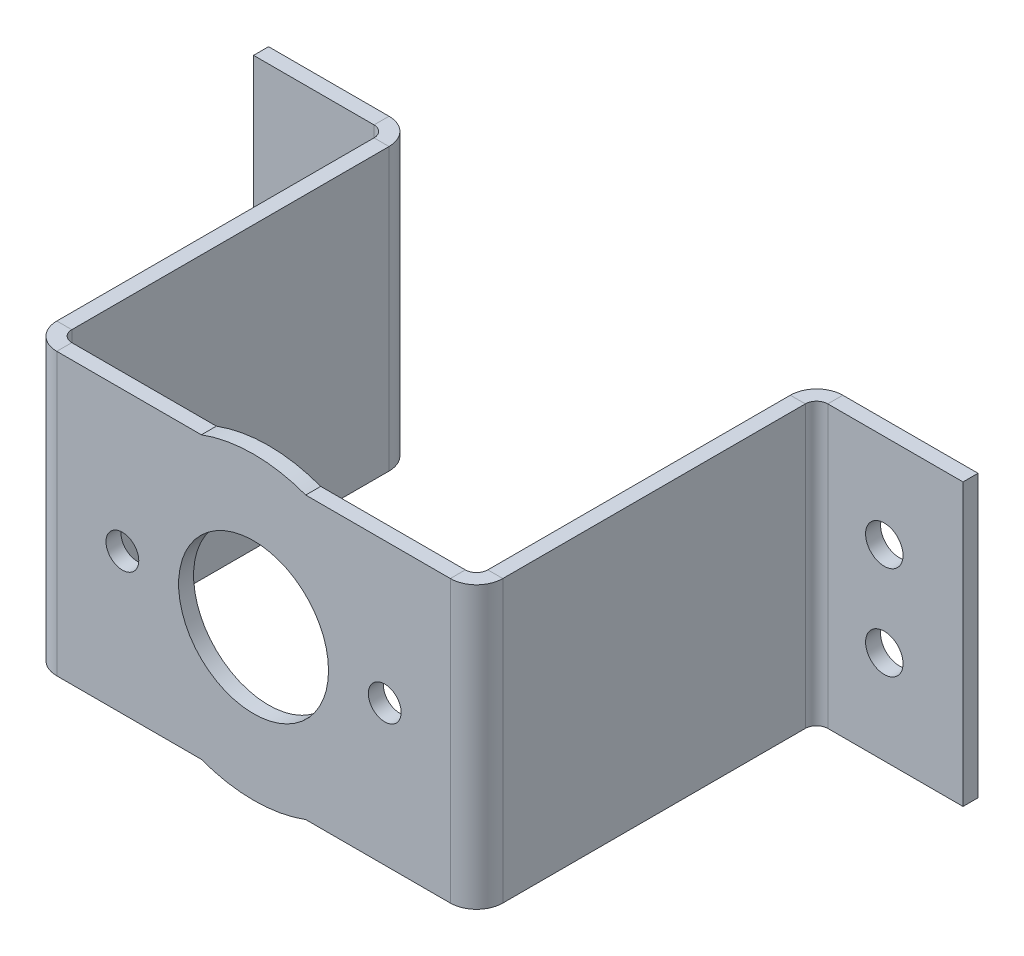
from build123d import *

# Parameters (mm, degrees)
SKETCH1_W                  = 149
SKETCH1_H                  = 30
BOSS_EXTRUDE1_DEPTH        = 1.6
SKETCH4_R                  = 16
BOSS_EXTRUDE2_DEPTH        = 1.6
SKETCH5_R                  = 8
CUT_EXTRUDE1_DEPTH         = 1.6
SKETCH6_R                  = 1.75
CUT_EXTRUDE2_DEPTH         = 1.6
SKETCH7_R                  = 2
CUT_EXTRUDE3_DEPTH         = 1.6
SKETCH8_W                  = 1
SKETCH8_H                  = 30
CUT_EXTRUDE4_DEPTH         = 1.6
SKETCHED_START             = 134.229203673
SKETCHED_BEND1_OUTLINE_W   = 30
SKETCHED_BEND1_OUTLINE_H   = 1.6
SKETCHED_BEND1_DEPTH       = 14.770796327
SKETCHED_START_2           = 132.629203673
SKETCHED_BEND1_2_OUTLINE_W = 30
SKETCHED_BEND1_2_OUTLINE_H = 15.629203673
SKETCHED_BEND1_2_OUTLINE_R = 2
SKETCHED_BEND1_2_DEPTH     = 1.304264
SKETCHED_START_3           = 134.060211673
SKETCHED_BEND1_3_OUTLINE_W = 30
SKETCHED_BEND1_3_OUTLINE_H = 1.6
SKETCHED_BEND1_3_DEPTH     = 0.168992
SKETCHED_START_4           = 131.429203673
SKETCHED_BEND1_4_OUTLINE_W = 30
SKETCHED_BEND1_4_OUTLINE_H = 15.629203673
SKETCHED_BEND1_4_OUTLINE_R = 2
SKETCHED_BEND1_4_DEPTH     = 2.8
SKETCHED_BEND1_5_DEPTH     = 30
SKETCHED_BEND3_DEPTH       = 30
SKETCHED_BEND3_2_DEPTH     = 7.9999999
SKETCHED_START_5           = 22.0000001
SKETCHED_BEND3_3_DEPTH     = 7.9999999
SKETCHED_START_6           = 12.0000001
SKETCHED_BEND3_4_DEPTH     = 5.9999998
SKETCHED_START_7           = 7.9999999
SKETCHED_BEND3_5_DEPTH     = 14.0000002
SKETCHED_START_8           = -36.28761102
SKETCHED_BEND3_6_OUTLINE_R = 2
SKETCHED_BEND3_6_DEPTH     = 1.6
SKETCHED_BEND4_DEPTH       = 30
SKETCHED_BEND4_2_DEPTH     = 7.9999999
SKETCHED_BEND4_3_DEPTH     = 7.9999999
SKETCHED_BEND4_4_DEPTH     = 5.9999998
SKETCHED_BEND4_5_DEPTH     = 14.0000002
SKETCHED_START_9           = 14.2
SKETCHED_BEND4_6_OUTLINE_R = 2
SKETCHED_BEND4_6_DEPTH     = 1.6
SKETCHED_BEND5_DEPTH       = 30
SKETCHED_BEND5_2_DEPTH     = 7.9999999
SKETCHED_BEND5_3_DEPTH     = 7.9999999
SKETCHED_BEND5_4_DEPTH     = 5.9999998
SKETCHED_BEND5_5_DEPTH     = 14.0000002
SKETCHED_START_10          = -37.858407346
SKETCHED_BEND5_6_OUTLINE_R = 2
SKETCHED_BEND5_6_DEPTH     = 1.6


with BuildPart() as part:
    # Sketch1 → Boss-Extrude1 (new body)
    with BuildSketch(Plane.XY):
        with Locations((74.5, 15)):
            Rectangle(SKETCH1_W, SKETCH1_H)
    extrude(amount=BOSS_EXTRUDE1_DEPTH)

    # Sketch4 → Boss-Extrude2 (add)
    with BuildSketch(Plane.XY.offset(1.6)):
        with Locations((75, 15)):
            Circle(SKETCH4_R)
    extrude(amount=-BOSS_EXTRUDE2_DEPTH)

    # Sketch5 → Cut-Extrude1 (cut)
    with BuildSketch(Plane.XY.offset(1.6)):
        with Locations((75, 15)):
            Circle(SKETCH5_R)
    extrude(amount=-CUT_EXTRUDE1_DEPTH, mode=Mode.SUBTRACT)

    # Sketch6 → Cut-Extrude2 (cut)
    with BuildSketch(Plane.XY.offset(1.6)):
        with Locations((89, 15)):
            Circle(SKETCH6_R)
        with Locations((61, 15.029414059)):
            Circle(SKETCH6_R)
    extrude(amount=-CUT_EXTRUDE2_DEPTH, mode=Mode.SUBTRACT)

    # Sketch7 → Cut-Extrude3 (cut)
    with BuildSketch(Plane.XY.offset(1.6)):
        with Locations((140.6, 20)):
            Circle(SKETCH7_R)
        with Locations((140.6, 10)):
            Circle(SKETCH7_R)
    cut_extrude3 = extrude(amount=-CUT_EXTRUDE3_DEPTH, mode=Mode.SUBTRACT)

    # Sketch8 → Cut-Extrude4 (cut)
    with BuildSketch(Plane.XY.offset(1.6)):
        with Locations((0.5, 15)):
            Rectangle(SKETCH8_W, SKETCH8_H)
    extrude(amount=-CUT_EXTRUDE4_DEPTH, mode=Mode.SUBTRACT)

    # Mirror1: Cut-Extrude3 across plane
    add(cut_extrude3.mirror(Plane(origin=(75, 0, 0), x_dir=(0, 0, 1), z_dir=(1, 0, 0))), mode=Mode.SUBTRACT)

    # Sketched Bend1: read off the stored shape, not the designer's step
    # Sketched Bend1 outline → Sketched Bend1 (cut)
    with BuildSketch(Plane.YZ.offset(SKETCHED_START)):
        with Locations((15, 0.8)):
            Rectangle(SKETCHED_BEND1_OUTLINE_W, SKETCHED_BEND1_OUTLINE_H)
    extrude(amount=SKETCHED_BEND1_DEPTH, mode=Mode.SUBTRACT)

    # Sketched Bend1 2 outline → Sketched Bend1 2 (add)
    with BuildSketch(Plane.YZ.offset(SKETCHED_START_2)):
        with Locations((15, 9.414601837)):
            Rectangle(SKETCHED_BEND1_2_OUTLINE_W, SKETCHED_BEND1_2_OUTLINE_H)
        with Locations((10, 8.829203673)):
            Circle(SKETCHED_BEND1_2_OUTLINE_R, mode=Mode.SUBTRACT)
        with Locations((20, 8.829203673)):
            Circle(SKETCHED_BEND1_2_OUTLINE_R, mode=Mode.SUBTRACT)
    extrude(amount=SKETCHED_BEND1_2_DEPTH)

    # Sketched Bend1 3 outline → Sketched Bend1 3 (cut)
    with BuildSketch(Plane.YZ.offset(SKETCHED_START_3)):
        with Locations((15, 0.8)):
            Rectangle(SKETCHED_BEND1_3_OUTLINE_W, SKETCHED_BEND1_3_OUTLINE_H)
    extrude(amount=SKETCHED_BEND1_3_DEPTH, mode=Mode.SUBTRACT)

    # Sketched Bend1 4 outline → Sketched Bend1 4 (add)
    with BuildSketch(Plane.YZ.offset(SKETCHED_START_4)):
        with Locations((15, 9.414601837)):
            Rectangle(SKETCHED_BEND1_4_OUTLINE_W, SKETCHED_BEND1_4_OUTLINE_H)
        with Locations((10, 8.829203673)):
            Circle(SKETCHED_BEND1_4_OUTLINE_R, mode=Mode.SUBTRACT)
        with Locations((20, 8.829203673)):
            Circle(SKETCHED_BEND1_4_OUTLINE_R, mode=Mode.SUBTRACT)
    extrude(amount=SKETCHED_BEND1_4_DEPTH)

    # Sketched Bend1 5 outline → Sketched Bend1 5 (cut)
    with BuildSketch(Plane(origin=(0, 0, 0), x_dir=(1, 0, 0), z_dir=(0, 1, 0))):
        with BuildLine():
            Line((131.429203673, -17.229203673), (132.629203673, -17.229203673))
            Line((132.629203673, -17.229203673), (132.629203673, -2.8))
            ThreePointArc((132.629203673, -2.8), (132.277731811, -1.951471862), (131.429203673, -1.6))
            Line((131.429203673, -1.6), (131.429203673, -17.229203673))
        make_face()
        with BuildLine():
            ThreePointArc((131.429203673, 0), (133.40910266, -0.820101012), (134.229203673, -2.8))
            Line((134.229203673, -2.8), (134.229203673, -1.6))
            Line((134.229203673, -1.6), (134.060211673, -1.6))
            Line((134.060211673, -1.6), (134.060211673, 0))
            Line((134.060211673, 0), (131.429203673, 0))
        make_face()
    extrude(amount=SKETCHED_BEND1_5_DEPTH, mode=Mode.SUBTRACT)

    # Sketched Bend3: read off the stored shape, not the designer's step
    # Sketched Bend3 outline → Sketched Bend3 (cut)
    with BuildSketch(Plane(origin=(0, 0, 0), x_dir=(1, 0, 0), z_dir=(0, 1, 0))):
        with BuildLine():
            Line((131.429203673, 0), (98.529822128, 0))
            ThreePointArc((98.529822128, 0), (97.496662954, -1.166431913), (96, -1.6))
            Line((96, -1.6), (131.429203673, -1.6))
            ThreePointArc((131.429203673, -1.6), (132.277731811, -1.951471862), (132.629203673, -2.8))
            Line((132.629203673, -2.8), (132.629203673, -17.229203673))
            Line((132.629203673, -17.229203673), (134.229203673, -17.229203673))
            Line((134.229203673, -17.229203673), (134.229203673, -2.8))
            ThreePointArc((134.229203673, -2.8), (133.40910266, -0.820101012), (131.429203673, 0))
        make_face()
    extrude(amount=SKETCHED_BEND3_DEPTH, mode=Mode.SUBTRACT)

    # Sketched Bend3 2 outline → Sketched Bend3 2 (add)
    with BuildSketch(Plane(origin=(0, 0, 0), x_dir=(1, 0, 0), z_dir=(0, 1, 0))):
        with BuildLine():
            ThreePointArc((100, 36.28761102), (98.020101013, 35.467510007), (97.2, 33.48761102))
            Line((97.2, 33.48761102), (97.2, 1.2))
            ThreePointArc((97.2, 1.2), (96.848528137, 0.351471863), (96, 0))
            Line((96, 0), (98.529822128, 0))
            ThreePointArc((98.529822128, 0), (98.731620577, 0.584980471), (98.8, 1.2))
            Line((98.8, 1.2), (98.8, 33.48761102))
            ThreePointArc((98.8, 33.48761102), (99.151471863, 34.336139157), (100, 34.68761102))
            Line((100, 34.68761102), (114.429203673, 34.68761102))
            Line((114.429203673, 34.68761102), (114.429203673, 36.28761102))
            Line((114.429203673, 36.28761102), (100, 36.28761102))
        make_face()
    extrude(amount=SKETCHED_BEND3_2_DEPTH)

    # Sketched Bend3 3 outline → Sketched Bend3 3 (add)
    with BuildSketch(Plane(origin=(0, 0, 0), x_dir=(1, 0, 0), z_dir=(0, 1, 0)).offset(SKETCHED_START_5)):
        with BuildLine():
            ThreePointArc((100, 36.28761102), (98.020101013, 35.467510007), (97.2, 33.48761102))
            Line((97.2, 33.48761102), (97.2, 1.2))
            ThreePointArc((97.2, 1.2), (96.848528137, 0.351471863), (96, 0))
            Line((96, 0), (98.529822128, 0))
            ThreePointArc((98.529822128, 0), (98.731620577, 0.584980471), (98.8, 1.2))
            Line((98.8, 1.2), (98.8, 33.48761102))
            ThreePointArc((98.8, 33.48761102), (99.151471863, 34.336139157), (100, 34.68761102))
            Line((100, 34.68761102), (114.429203673, 34.68761102))
            Line((114.429203673, 34.68761102), (114.429203673, 36.28761102))
            Line((114.429203673, 36.28761102), (100, 36.28761102))
        make_face()
    extrude(amount=SKETCHED_BEND3_3_DEPTH)

    # Sketched Bend3 4 outline → Sketched Bend3 4 (add)
    with BuildSketch(Plane(origin=(0, 0, 0), x_dir=(1, 0, 0), z_dir=(0, 1, 0)).offset(SKETCHED_START_6)):
        with BuildLine():
            ThreePointArc((100, 36.28761102), (98.020101013, 35.467510007), (97.2, 33.48761102))
            Line((97.2, 33.48761102), (97.2, 1.2))
            ThreePointArc((97.2, 1.2), (96.848528137, 0.351471863), (96, 0))
            Line((96, 0), (98.529822128, 0))
            ThreePointArc((98.529822128, 0), (98.731620577, 0.584980471), (98.8, 1.2))
            Line((98.8, 1.2), (98.8, 33.48761102))
            ThreePointArc((98.8, 33.48761102), (99.151471863, 34.336139157), (100, 34.68761102))
            Line((100, 34.68761102), (114.429203673, 34.68761102))
            Line((114.429203673, 34.68761102), (114.429203673, 36.28761102))
            Line((114.429203673, 36.28761102), (100, 36.28761102))
        make_face()
    extrude(amount=SKETCHED_BEND3_4_DEPTH)

    # Sketched Bend3 5 outline → Sketched Bend3 5 (add)
    with BuildSketch(Plane(origin=(0, 0, 0), x_dir=(1, 0, 0), z_dir=(0, 1, 0)).offset(SKETCHED_START_7)):
        with BuildLine():
            ThreePointArc((100, 36.28761102), (98.020101013, 35.467510007), (97.2, 33.48761102))
            Line((97.2, 33.48761102), (97.2, 1.2))
            ThreePointArc((97.2, 1.2), (96.848528137, 0.351471863), (96, 0))
            Line((96, 0), (98.529822128, 0))
            ThreePointArc((98.529822128, 0), (98.731620577, 0.584980471), (98.8, 1.2))
            Line((98.8, 1.2), (98.8, 33.48761102))
            ThreePointArc((98.8, 33.48761102), (99.151471863, 34.336139157), (100, 34.68761102))
            Line((100, 34.68761102), (114.429203673, 34.68761102))
            Line((114.429203673, 34.68761102), (114.429203673, 36.28761102))
            Line((114.429203673, 36.28761102), (100, 36.28761102))
        make_face()
    extrude(amount=SKETCHED_BEND3_5_DEPTH)

    # Sketched Bend3 6 outline → Sketched Bend3 6 (cut)
    with BuildSketch(Plane.XY.offset(SKETCHED_START_8)):
        with Locations((106.029203673, 20)):
            Circle(SKETCHED_BEND3_6_OUTLINE_R)
        with Locations((106.029203673, 10)):
            Circle(SKETCHED_BEND3_6_OUTLINE_R)
    extrude(amount=SKETCHED_BEND3_6_DEPTH, mode=Mode.SUBTRACT)

    # Sketched Bend4: read off the stored shape, not the designer's step
    # Sketched Bend4 outline → Sketched Bend4 (cut)
    with BuildSketch(Plane(origin=(0, 0, 0), x_dir=(1, 0, 0), z_dir=(0, 1, 0))):
        with BuildLine():
            Line((1, -1.6), (14.470177872, -1.6))
            ThreePointArc((14.470177872, -1.6), (15.503337046, -0.433568087), (17, 0))
            Line((17, 0), (1, 0))
            Line((1, 0), (1, -1.6))
        make_face()
    extrude(amount=SKETCHED_BEND4_DEPTH, mode=Mode.SUBTRACT)

    # Sketched Bend4 2 outline → Sketched Bend4 2 (add)
    with BuildSketch(Plane(origin=(0, 0, 0), x_dir=(1, 0, 0), z_dir=(0, 1, 0))):
        with BuildLine():
            Line((15.8, -15.658407346), (15.8, -2.8))
            ThreePointArc((15.8, -2.8), (16.151471863, -1.951471863), (17, -1.6))
            Line((17, -1.6), (14.470177872, -1.6))
            ThreePointArc((14.470177872, -1.6), (14.268379423, -2.184980471), (14.2, -2.8))
            Line((14.2, -2.8), (14.2, -15.658407346))
            Line((14.2, -15.658407346), (15.8, -15.658407346))
        make_face()
    extrude(amount=SKETCHED_BEND4_2_DEPTH)

    # Sketched Bend4 3 outline → Sketched Bend4 3 (add)
    with BuildSketch(Plane(origin=(0, 0, 0), x_dir=(1, 0, 0), z_dir=(0, 1, 0)).offset(SKETCHED_START_5)):
        with BuildLine():
            Line((15.8, -15.658407346), (15.8, -2.8))
            ThreePointArc((15.8, -2.8), (16.151471863, -1.951471863), (17, -1.6))
            Line((17, -1.6), (14.470177872, -1.6))
            ThreePointArc((14.470177872, -1.6), (14.268379423, -2.184980471), (14.2, -2.8))
            Line((14.2, -2.8), (14.2, -15.658407346))
            Line((14.2, -15.658407346), (15.8, -15.658407346))
        make_face()
    extrude(amount=SKETCHED_BEND4_3_DEPTH)

    # Sketched Bend4 4 outline → Sketched Bend4 4 (add)
    with BuildSketch(Plane(origin=(0, 0, 0), x_dir=(1, 0, 0), z_dir=(0, 1, 0)).offset(SKETCHED_START_6)):
        with BuildLine():
            Line((15.8, -15.658407346), (15.8, -2.8))
            ThreePointArc((15.8, -2.8), (16.151471863, -1.951471863), (17, -1.6))
            Line((17, -1.6), (14.470177872, -1.6))
            ThreePointArc((14.470177872, -1.6), (14.268379423, -2.184980471), (14.2, -2.8))
            Line((14.2, -2.8), (14.2, -15.658407346))
            Line((14.2, -15.658407346), (15.8, -15.658407346))
        make_face()
    extrude(amount=SKETCHED_BEND4_4_DEPTH)

    # Sketched Bend4 5 outline → Sketched Bend4 5 (add)
    with BuildSketch(Plane(origin=(0, 0, 0), x_dir=(1, 0, 0), z_dir=(0, 1, 0)).offset(SKETCHED_START_7)):
        with BuildLine():
            Line((15.8, -15.658407346), (15.8, -2.8))
            ThreePointArc((15.8, -2.8), (16.151471863, -1.951471863), (17, -1.6))
            Line((17, -1.6), (14.470177872, -1.6))
            ThreePointArc((14.470177872, -1.6), (14.268379423, -2.184980471), (14.2, -2.8))
            Line((14.2, -2.8), (14.2, -15.658407346))
            Line((14.2, -15.658407346), (15.8, -15.658407346))
        make_face()
    extrude(amount=SKETCHED_BEND4_5_DEPTH)

    # Sketched Bend4 6 outline → Sketched Bend4 6 (cut)
    with BuildSketch(Plane.YZ.offset(SKETCHED_START_9)):
        with Locations((20, 7.258407346)):
            Circle(SKETCHED_BEND4_6_OUTLINE_R)
        with Locations((10, 7.258407346)):
            Circle(SKETCHED_BEND4_6_OUTLINE_R)
    extrude(amount=SKETCHED_BEND4_6_DEPTH, mode=Mode.SUBTRACT)

    # Sketched Bend5: read off the stored shape, not the designer's step
    # Sketched Bend5 outline → Sketched Bend5 (cut)
    with BuildSketch(Plane(origin=(0, 0, 0), x_dir=(1, 0, 0), z_dir=(0, 1, 0))):
        with BuildLine():
            Line((17, -1.6), (54, -1.6))
            ThreePointArc((54, -1.6), (52.503337046, -1.166431913), (51.470177872, 0))
            Line((51.470177872, 0), (17, 0))
            ThreePointArc((17, 0), (15.020101013, -0.820101013), (14.2, -2.8))
            Line((14.2, -2.8), (14.2, -15.658407346))
            Line((14.2, -15.658407346), (15.8, -15.658407346))
            Line((15.8, -15.658407346), (15.8, -2.8))
            ThreePointArc((15.8, -2.8), (16.151471863, -1.951471863), (17, -1.6))
        make_face()
    extrude(amount=SKETCHED_BEND5_DEPTH, mode=Mode.SUBTRACT)

    # Sketched Bend5 2 outline → Sketched Bend5 2 (add)
    with BuildSketch(Plane(origin=(0, 0, 0), x_dir=(1, 0, 0), z_dir=(0, 1, 0))):
        with BuildLine():
            ThreePointArc((51.2, 1.2), (51.268379423, 0.584980471), (51.470177872, 0))
            Line((51.470177872, 0), (54, 0))
            ThreePointArc((54, 0), (53.151471863, 0.351471863), (52.8, 1.2))
            Line((52.8, 1.2), (52.8, 35.058407346))
            ThreePointArc((52.8, 35.058407346), (51.979898987, 37.038306333), (50, 37.858407346))
            Line((50, 37.858407346), (37.141592654, 37.858407346))
            Line((37.141592654, 37.858407346), (37.141592654, 36.258407346))
            Line((37.141592654, 36.258407346), (50, 36.258407346))
            ThreePointArc((50, 36.258407346), (50.848528138, 35.906935483), (51.2, 35.058407346))
            Line((51.2, 35.058407346), (51.2, 1.2))
        make_face()
    extrude(amount=SKETCHED_BEND5_2_DEPTH)

    # Sketched Bend5 3 outline → Sketched Bend5 3 (add)
    with BuildSketch(Plane(origin=(0, 0, 0), x_dir=(1, 0, 0), z_dir=(0, 1, 0)).offset(SKETCHED_START_5)):
        with BuildLine():
            ThreePointArc((51.2, 1.2), (51.268379423, 0.584980471), (51.470177872, 0))
            Line((51.470177872, 0), (54, 0))
            ThreePointArc((54, 0), (53.151471863, 0.351471863), (52.8, 1.2))
            Line((52.8, 1.2), (52.8, 35.058407346))
            ThreePointArc((52.8, 35.058407346), (51.979898987, 37.038306333), (50, 37.858407346))
            Line((50, 37.858407346), (37.141592654, 37.858407346))
            Line((37.141592654, 37.858407346), (37.141592654, 36.258407346))
            Line((37.141592654, 36.258407346), (50, 36.258407346))
            ThreePointArc((50, 36.258407346), (50.848528138, 35.906935483), (51.2, 35.058407346))
            Line((51.2, 35.058407346), (51.2, 1.2))
        make_face()
    extrude(amount=SKETCHED_BEND5_3_DEPTH)

    # Sketched Bend5 4 outline → Sketched Bend5 4 (add)
    with BuildSketch(Plane(origin=(0, 0, 0), x_dir=(1, 0, 0), z_dir=(0, 1, 0)).offset(SKETCHED_START_6)):
        with BuildLine():
            ThreePointArc((51.2, 1.2), (51.268379423, 0.584980471), (51.470177872, 0))
            Line((51.470177872, 0), (54, 0))
            ThreePointArc((54, 0), (53.151471863, 0.351471863), (52.8, 1.2))
            Line((52.8, 1.2), (52.8, 35.058407346))
            ThreePointArc((52.8, 35.058407346), (51.979898987, 37.038306333), (50, 37.858407346))
            Line((50, 37.858407346), (37.141592654, 37.858407346))
            Line((37.141592654, 37.858407346), (37.141592654, 36.258407346))
            Line((37.141592654, 36.258407346), (50, 36.258407346))
            ThreePointArc((50, 36.258407346), (50.848528138, 35.906935483), (51.2, 35.058407346))
            Line((51.2, 35.058407346), (51.2, 1.2))
        make_face()
    extrude(amount=SKETCHED_BEND5_4_DEPTH)

    # Sketched Bend5 5 outline → Sketched Bend5 5 (add)
    with BuildSketch(Plane(origin=(0, 0, 0), x_dir=(1, 0, 0), z_dir=(0, 1, 0)).offset(SKETCHED_START_7)):
        with BuildLine():
            ThreePointArc((51.2, 1.2), (51.268379423, 0.584980471), (51.470177872, 0))
            Line((51.470177872, 0), (54, 0))
            ThreePointArc((54, 0), (53.151471863, 0.351471863), (52.8, 1.2))
            Line((52.8, 1.2), (52.8, 35.058407346))
            ThreePointArc((52.8, 35.058407346), (51.979898987, 37.038306333), (50, 37.858407346))
            Line((50, 37.858407346), (37.141592654, 37.858407346))
            Line((37.141592654, 37.858407346), (37.141592654, 36.258407346))
            Line((37.141592654, 36.258407346), (50, 36.258407346))
            ThreePointArc((50, 36.258407346), (50.848528138, 35.906935483), (51.2, 35.058407346))
            Line((51.2, 35.058407346), (51.2, 1.2))
        make_face()
    extrude(amount=SKETCHED_BEND5_5_DEPTH)

    # Sketched Bend5 6 outline → Sketched Bend5 6 (cut)
    with BuildSketch(Plane.XY.offset(SKETCHED_START_10)):
        with Locations((45.541592654, 20)):
            Circle(SKETCHED_BEND5_6_OUTLINE_R)
        with Locations((45.541592654, 10)):
            Circle(SKETCHED_BEND5_6_OUTLINE_R)
    extrude(amount=SKETCHED_BEND5_6_DEPTH, mode=Mode.SUBTRACT)


solid = part.part
